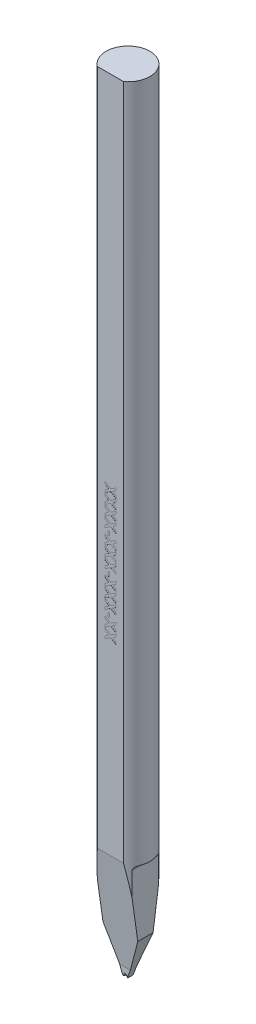
from build123d import *

# Parameters (mm, degrees)
SKETCH_TL_CUTTING_R       = 1.99771
TL_CUTTING_DEPTH          = 72.009
SKETCH_TDF_GRINDING_W     = 4.01542
SKETCH_TDF_GRINDING_H     = 4.01542
TDF_GRINDING_DEPTH        = 73.064400167
SKETCH_ENGRAVING_W        = 0.166666667
SKETCH_ENGRAVING_H        = 0.371794872
ENGRAVING_DEPTH           = 0.005
VW_VR_GRINDING_DEPTH      = 2.00771
VW_VR_GRINDING_DEPTH_BACK = 2.00771
ISA_GRINDING_DEPTH        = 2.00771
ISA_GRINDING_DEPTH_BACK   = 2.00771
PRE_FRX_BRX_DEPTH         = 2.00771
PRE_FRX_BRX_DEPTH_BACK    = 2.00771
SKETCH_PRE_FRX_BRX_W      = 1.7372
SKETCH_PRE_FRX_BRX_H      = 0.78994
FR_EDM_R                  = 0.20066
BR_EDM_R                  = 0.09906
FA_BA_GRINDING_DEPTH      = 2.00771
FA_BA_GRINDING_DEPTH_BACK = 2.00771


with BuildPart() as part:
    # sketch_TL_cutting → TL_cutting (new body)
    with BuildSketch(Plane(origin=(0, 0, 0), x_dir=(1, 0, 0), z_dir=(0, 1, 0))):
        Circle(SKETCH_TL_CUTTING_R)
    extrude(amount=TL_CUTTING_DEPTH)

    # sketch_TDF_grinding → TDF_grinding (cut, through all)
    with BuildSketch(Plane(origin=(0, 0, 0), x_dir=(1, 0, 0), z_dir=(0, 1, 0))):
        with Locations((0, -3.60918)):
            Rectangle(SKETCH_TDF_GRINDING_W, SKETCH_TDF_GRINDING_H)
    extrude(amount=TDF_GRINDING_DEPTH, mode=Mode.SUBTRACT)

    # sketch_engraving → engraving (cut)
    with BuildSketch(Plane.XY.offset(1.60147)):
        Polygon((-0.5, 39.598539744), (0.029647436, 39.255791346), (0.5, 39.560078205), (0.5, 39.33531859), (0.203325321, 39.143411538), (0.5, 38.951504487), (0.5, 38.726744872), (0.029647436, 39.031031731), (-0.5, 38.688283333), (-0.5, 38.913042949), (-0.144030449, 39.143411538), (-0.5, 39.373780128), align=None)
        Polygon((-0.5, 38.675462821), (0.029647436, 38.332714423), (0.5, 38.637001282), (0.5, 38.412241667), (0.203325321, 38.220334615), (0.5, 38.028427564), (0.5, 37.803667949), (0.029647436, 38.107954808), (-0.5, 37.76520641), (-0.5, 37.989966026), (-0.144030449, 38.220334615), (-0.5, 38.450703205), align=None)
        Polygon((-0.5, 37.752385897), (0.029647436, 37.4096375), (0.5, 37.713924359), (0.5, 37.489164744), (0.203325321, 37.297257692), (0.5, 37.105350641), (0.5, 36.880591026), (0.029647436, 37.184877885), (-0.5, 36.842129487), (-0.5, 37.066889103), (-0.144030449, 37.297257692), (-0.5, 37.527626282), align=None)
        Polygon((-0.5, 36.829308974), (0.029647436, 36.486560577), (0.5, 36.790847436), (0.5, 36.566087821), (0.203325321, 36.374180769), (0.5, 36.182273718), (0.5, 35.957514103), (0.029647436, 36.261800962), (-0.5, 35.919052564), (-0.5, 36.143812179), (-0.144030449, 36.374180769), (-0.5, 36.604549359), align=None)
        with Locations((-0.147435898, 35.649821795)):
            Rectangle(SKETCH_ENGRAVING_W, SKETCH_ENGRAVING_H)
        Polygon((-0.5, 35.44469359), (0.029647436, 35.101945192), (0.5, 35.406232051), (0.5, 35.181472436), (0.203325321, 34.989565385), (0.5, 34.797658333), (0.5, 34.572898718), (0.029647436, 34.877185577), (-0.5, 34.534437179), (-0.5, 34.759196795), (-0.144030449, 34.989565385), (-0.5, 35.219933974), align=None)
        Polygon((-0.5, 34.521616667), (0.029647436, 34.178868269), (0.5, 34.483155128), (0.5, 34.258395513), (0.203325321, 34.066488462), (0.5, 33.87458141), (0.5, 33.649821795), (0.029647436, 33.954108654), (-0.5, 33.611360256), (-0.5, 33.836119872), (-0.144030449, 34.066488462), (-0.5, 34.296857051), align=None)
        Polygon((-0.5, 33.598539744), (0.029647436, 33.255791346), (0.5, 33.560078205), (0.5, 33.33531859), (0.203325321, 33.143411538), (0.5, 32.951504487), (0.5, 32.726744872), (0.029647436, 33.031031731), (-0.5, 32.688283333), (-0.5, 32.913042949), (-0.144030449, 33.143411538), (-0.5, 33.373780128), align=None)
        with Locations((-0.147435898, 32.419052564)):
            Rectangle(SKETCH_ENGRAVING_W, SKETCH_ENGRAVING_H)
        Polygon((-0.5, 32.213924359), (0.029647436, 31.871175962), (0.5, 32.175462821), (0.5, 31.950703205), (0.203325321, 31.758796154), (0.5, 31.566889103), (0.5, 31.342129487), (0.029647436, 31.646416346), (-0.5, 31.303667949), (-0.5, 31.528427564), (-0.144030449, 31.758796154), (-0.5, 31.989164744), align=None)
        Polygon((-0.5, 31.290847436), (0.029647436, 30.948099038), (0.5, 31.252385897), (0.5, 31.027626282), (0.203325321, 30.835719231), (0.5, 30.643812179), (0.5, 30.419052564), (0.029647436, 30.723339423), (-0.5, 30.380591026), (-0.5, 30.605350641), (-0.144030449, 30.835719231), (-0.5, 31.066087821), align=None)
        Polygon((-0.5, 30.367770513), (0.029647436, 30.025022115), (0.5, 30.329308974), (0.5, 30.104549359), (0.203325321, 29.912642308), (0.5, 29.720735256), (0.5, 29.495975641), (0.029647436, 29.8002625), (-0.5, 29.457514103), (-0.5, 29.682273718), (-0.144030449, 29.912642308), (-0.5, 30.143010897), align=None)
        with Locations((-0.147435898, 29.188283333)):
            Rectangle(SKETCH_ENGRAVING_W, SKETCH_ENGRAVING_H)
        Polygon((-0.5, 28.983155128), (0.029647436, 28.640406731), (0.5, 28.94469359), (0.5, 28.719933974), (0.203325321, 28.528026923), (0.5, 28.336119872), (0.5, 28.111360256), (0.029647436, 28.415647115), (-0.5, 28.072898718), (-0.5, 28.297658333), (-0.144030449, 28.528026923), (-0.5, 28.758395513), align=None)
        Polygon((-0.5, 28.060078205), (0.029647436, 27.717329808), (0.5, 28.021616667), (0.5, 27.796857051), (0.203325321, 27.60495), (0.5, 27.413042949), (0.5, 27.188283333), (0.029647436, 27.492570192), (-0.5, 27.149821795), (-0.5, 27.37458141), (-0.144030449, 27.60495), (-0.5, 27.83531859), align=None)
    extrude(amount=-ENGRAVING_DEPTH, mode=Mode.SUBTRACT)

    # sketch_VW_VR_grinding → VW_VR_grinding (cut, two sides: drawn at the far end of the back side and taken through both)
    with BuildSketch(Plane.XY.offset(-VW_VR_GRINDING_DEPTH_BACK)):
        with BuildLine():
            Line((-1.59004, -0.01), (-1.59004, 9.681972))
            ThreePointArc((-1.59004, 9.681972), (-1.683182387, 9.906837613), (-1.908048, 9.99998))
            Line((-1.908048, 9.99998), (-2.00771, 9.99998))
            Line((-2.00771, 9.99998), (-2.00771, -0.01))
            Line((-2.00771, -0.01), (-1.59004, -0.01))
        make_face()
        with BuildLine():
            Line((1.59004, -0.01), (1.59004, 9.681972))
            ThreePointArc((1.59004, 9.681972), (1.683182387, 9.906837613), (1.908048, 9.99998))
            Line((1.908048, 9.99998), (2.00771, 9.99998))
            Line((2.00771, 9.99998), (2.00771, -0.01))
            Line((2.00771, -0.01), (1.59004, -0.01))
        make_face()
    extrude(amount=VW_VR_GRINDING_DEPTH + VW_VR_GRINDING_DEPTH_BACK, mode=Mode.SUBTRACT)

    # sketch_ISA_grinding → ISA_grinding (cut, two sides: drawn at the far end of the back side and taken through both)
    with BuildSketch(Plane.XY.offset(-ISA_GRINDING_DEPTH_BACK)):
        Polygon((-0.19939, 0), (-2.00771, 4.968318367), (-2.00771, -0.01), (2.00771, -0.01), (2.00771, 4.968318367), (0.19939, 0), align=None)
    extrude(amount=ISA_GRINDING_DEPTH + ISA_GRINDING_DEPTH_BACK, mode=Mode.SUBTRACT)

    # sketch_pre_FRX_BRX → pre_FRX_BRX (cut, two sides: drawn at the far end of the back side and taken through both)
    with BuildSketch(Plane(origin=(0, 0, 0), x_dir=(0, 0, -1), z_dir=(1, 0, 0)).offset(-PRE_FRX_BRX_DEPTH_BACK)):
        with Locations((-1.13911, 0.38497)):
            Rectangle(SKETCH_PRE_FRX_BRX_W, SKETCH_PRE_FRX_BRX_H)
        with Locations((1.13911, 0.38497)):
            Rectangle(SKETCH_PRE_FRX_BRX_W, SKETCH_PRE_FRX_BRX_H)
    extrude(amount=PRE_FRX_BRX_DEPTH + PRE_FRX_BRX_DEPTH_BACK, mode=Mode.SUBTRACT)

    # V-Groove_EDM: sweep along a path in sketch_contour_V-Groove
    with BuildLine(Plane(origin=(0, 0, 0), x_dir=(0, 0, -1), z_dir=(1, 0, 0))) as v_groove_edm_path:
        Line((-1.60147, 0.11176), (0, 0.11176))
        Line((0, 0.11176), (1.99771, 0.11176))
    # sketch_section_V-Groove → V-Groove_EDM (sweep, cut)
    with BuildSketch(Plane.XY.offset(1.60147)):
        with BuildLine():
            Line((-1.23952, -1.1176), (-0.017344205, 0.104575795))
            ThreePointArc((-0.017344205, 0.104575795), (0, 0.11176), (0.017344205, 0.104575795))
            Line((0.017344205, 0.104575795), (1.23952, -1.1176))
            Line((1.23952, -1.1176), (-1.23952, -1.1176))
        make_face()
    sweep(path=v_groove_edm_path.line, mode=Mode.SUBTRACT)

    # FR_EDM
    fr_edm_edges = [part.edges().sort_by_distance(p)[0] for p in [
        (0.069632102, 0.052287898, 0.27051),
        (0, 0.11176, 0.27051),
        (-0.069632102, 0.052287898, 0.27051),
    ]]
    fillet(fr_edm_edges, radius=FR_EDM_R)

    # BR_EDM
    br_edm_edges = [part.edges().sort_by_distance(p)[0] for p in [
        (0.069632102, 0.052287898, -0.27051),
        (0, 0.11176, -0.27051),
        (-0.069632102, 0.052287898, -0.27051),
    ]]
    fillet(br_edm_edges, radius=BR_EDM_R)

    # sketch_FA_BA_grinding → FA_BA_grinding (cut, two sides: drawn at the far end of the back side and taken through both)
    with BuildSketch(Plane(origin=(0, 0, 0), x_dir=(0, 0, -1), z_dir=(1, 0, 0)).offset(-FA_BA_GRINDING_DEPTH_BACK)):
        Polygon((2.99771, 20.194976307), (2.99771, -0.1), (0.27051, -0.1), (0.27051, 0.78994), align=None)
        Polygon((-3.218218656, 21.763976919), (-0.27051, 0.78994), (-0.27051, -0.1), (-3.218218656, -0.1), align=None)
    extrude(amount=FA_BA_GRINDING_DEPTH + FA_BA_GRINDING_DEPTH_BACK, mode=Mode.SUBTRACT)


solid = part.part
